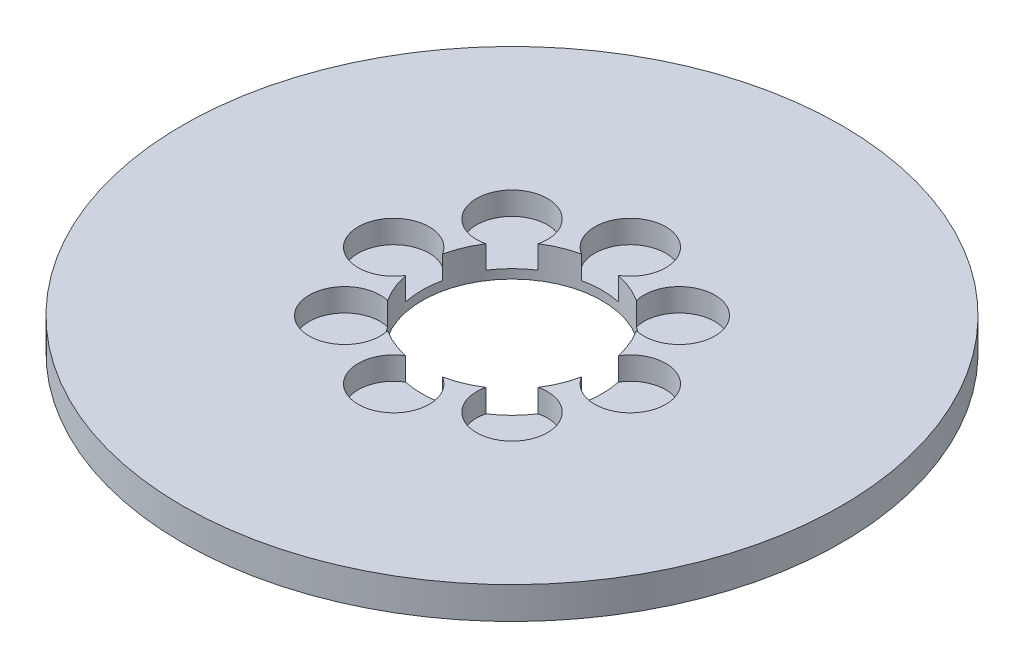
from build123d import *

# Parameters (mm, degrees)
SKETCH1_R           = 82.5
BOSS_EXTRUDE1_DEPTH = 8
SKETCH2_R           = 22.5
CUT_EXTRUDE1_DEPTH  = 117.946568996
SKETCH3_R           = 8.891902411
CUT_EXTRUDE2_DEPTH  = 5.731573304
CIRPATTERN1_COUNT   = 8


with BuildPart() as part:
    # Sketch1 → Boss-Extrude1 (new body)
    with BuildSketch(Plane(origin=(0, 0, 0), x_dir=(1, 0, 0), z_dir=(0, 1, 0))):
        Circle(SKETCH1_R)
    extrude(amount=BOSS_EXTRUDE1_DEPTH)

    # Sketch2 → Cut-Extrude1 (cut, through all)
    with BuildSketch(Plane(origin=(0, 0, 0), x_dir=(1, 0, 0), z_dir=(0, 1, 0))):
        Circle(SKETCH2_R)
    extrude(amount=CUT_EXTRUDE1_DEPTH, mode=Mode.SUBTRACT)

    # Sketch3 → Cut-Extrude2 (cut)
    with BuildSketch(Plane(origin=(0, 8, 0), x_dir=(1, 0, 0), z_dir=(0, 1, 0))):
        with Locations((-29.613204402, 0)):
            Circle(SKETCH3_R)
    cut_extrude2 = extrude(amount=-CUT_EXTRUDE2_DEPTH, mode=Mode.SUBTRACT)

    # CirPattern1: Cut-Extrude2 ×8 about axis
    cirpattern1_axis = Axis((0, 0, 0), (0, 1, 0))
    for i in range(1, CIRPATTERN1_COUNT):
        add(cut_extrude2.rotate(cirpattern1_axis, i * 360 / CIRPATTERN1_COUNT), mode=Mode.SUBTRACT)


solid = part.part
